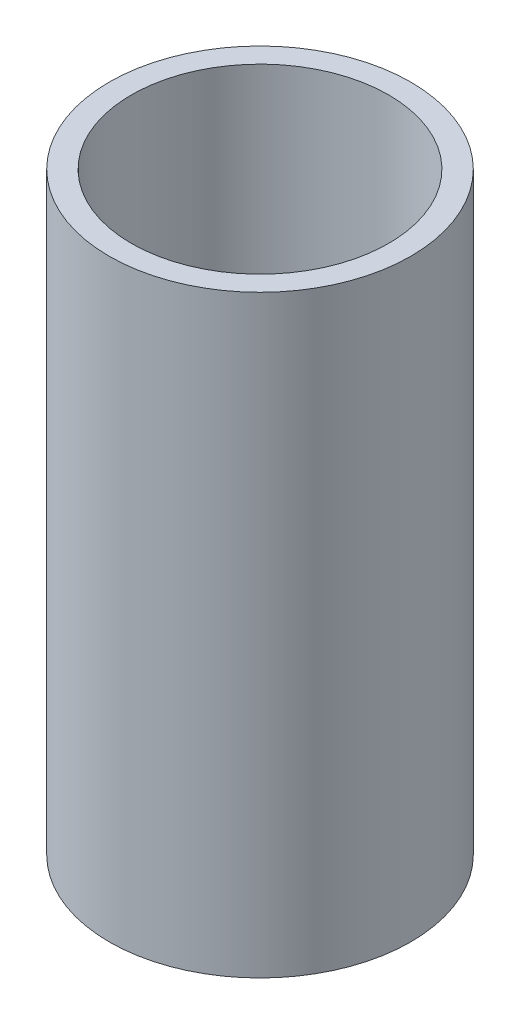
from build123d import *

# Parameters (mm, degrees)
SKETCH1_R           = 15.24
SKETCH1_R_2         = 13
BOSS_EXTRUDE1_DEPTH = 60


with BuildPart() as part:
    # Sketch1 → Boss-Extrude1 (new body)
    with BuildSketch(Plane(origin=(0, 0, 0), x_dir=(1, 0, 0), z_dir=(0, 1, 0))):
        Circle(SKETCH1_R)
        Circle(SKETCH1_R_2, mode=Mode.SUBTRACT)
    extrude(amount=BOSS_EXTRUDE1_DEPTH)


solid = part.part
